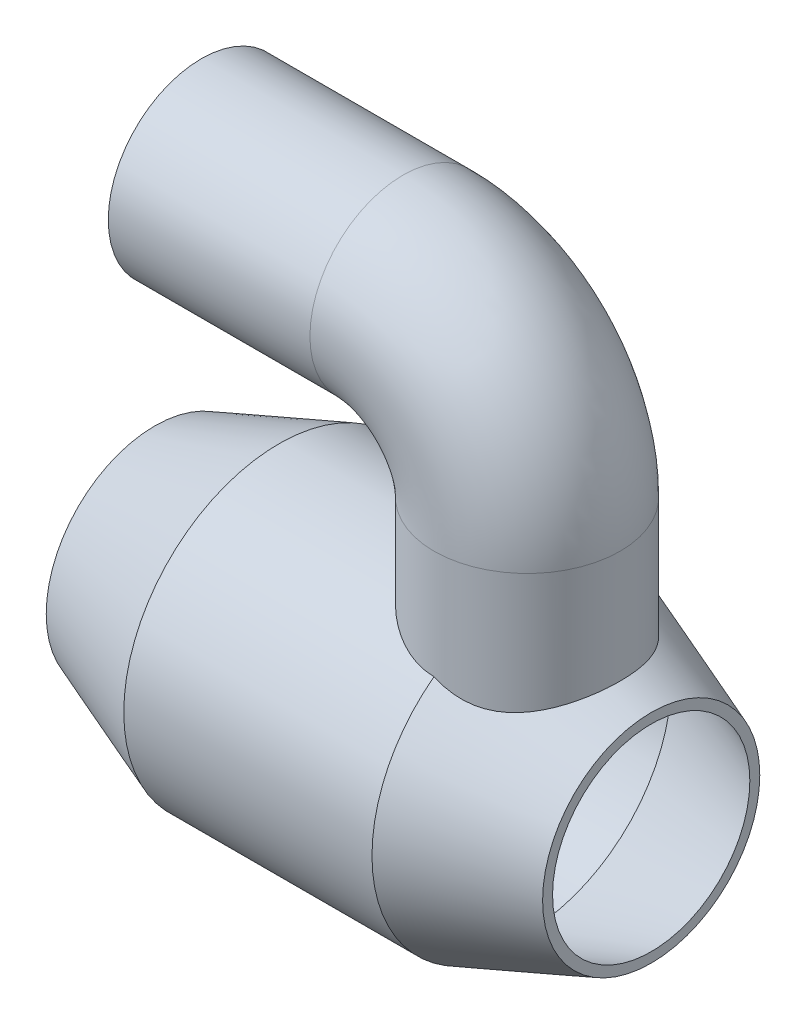
from build123d import *

# Parameters (mm, degrees)
SKETCH_4_R = 30
SHELL_1_T  = -3


with BuildPart() as part:
    # 草圖2 → 旋轉3 (revolve)
    with BuildSketch(Plane.XY):
        Polygon((-80, 35), (-40, 50), (40, 50), (80, 35), (80, 0), (-80, 0), align=None)
    revolve(axis=Axis((-81.523809524, 0, 0), (1, 0, 0)))

    # 掃出1: sweep along a path in 草圖3
    with BuildLine(Plane.XY) as sweep_1_path:
        Line((-65, 115), (0, 115))
        ThreePointArc((0, 115), (28.284271247, 103.284271247), (40, 75))
        Line((40, 75), (40, 0))
    # 草圖4 → 掃出1 (sweep)
    with BuildSketch(Plane(origin=(0, 0, 0), x_dir=(1, 0, 0), z_dir=(0, 1, 0))):
        with Locations((40, 0)):
            Circle(SKETCH_4_R)
    sweep(path=sweep_1_path.line)

    # 薄殼1
    shell_1_openings = [part.faces().sort_by_distance(p)[0] for p in [
        (80, 0, 0),
        (-80, 0, 0),
        (-65, 115, 0),
    ]]
    offset(amount=SHELL_1_T, openings=shell_1_openings, kind=Kind.INTERSECTION)


solid = part.part
